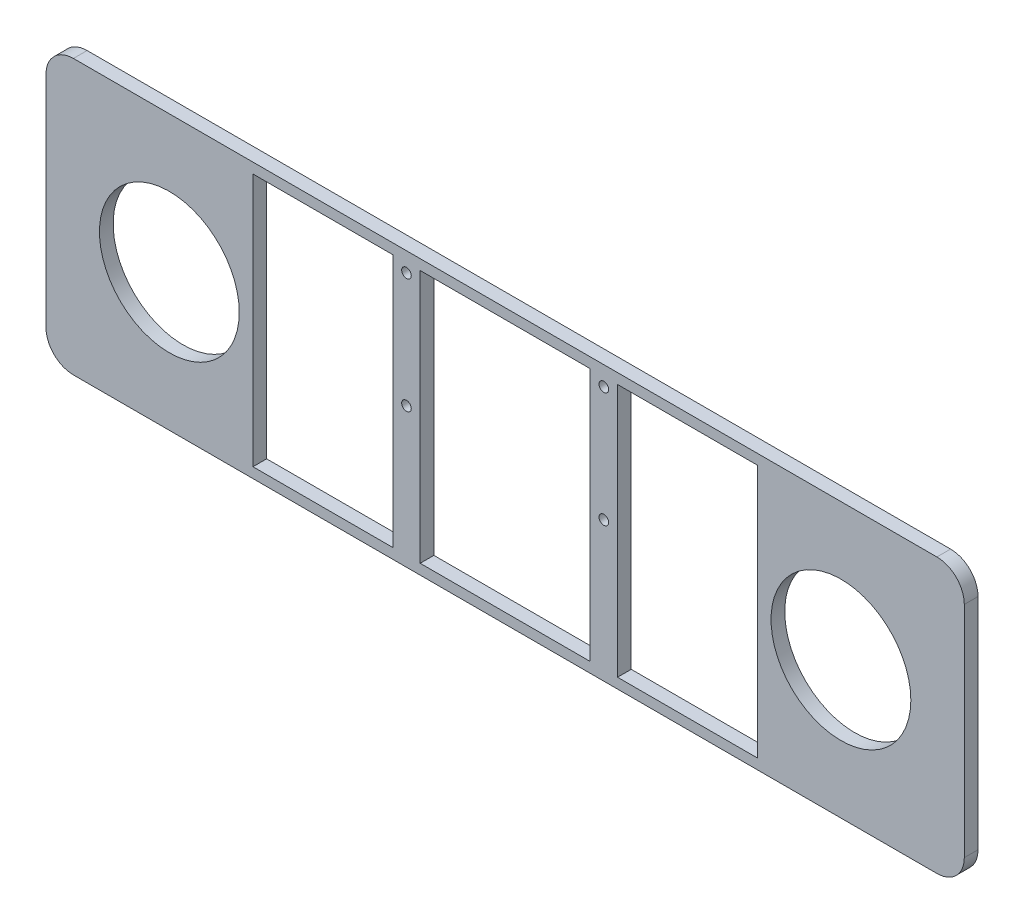
from build123d import *

# Parameters (mm, degrees)
SKETCH1_W           = 335
SKETCH1_H           = 100
SKETCH1_R           = 1.75
SKETCH1_R_2         = 25.5
SKETCH1_W_2         = 62
SKETCH1_H_2         = 92.5
SKETCH1_W_3         = 51
BOSS_EXTRUDE1_DEPTH = 5
FILLET1_R           = 10


with BuildPart() as part:
    # Sketch1 → Boss-Extrude1 (new body)
    with BuildSketch(Plane.XY):
        Rectangle(SKETCH1_W, SKETCH1_H)
        with Locations((-36, 43)):
            Circle(SKETCH1_R, mode=Mode.SUBTRACT)
        with Locations((36, 43)):
            Circle(SKETCH1_R, mode=Mode.SUBTRACT)
        with Locations((36, 1)):
            Circle(SKETCH1_R, mode=Mode.SUBTRACT)
        with Locations((-36, 1)):
            Circle(SKETCH1_R, mode=Mode.SUBTRACT)
        with Locations((-122.5, 0)):
            Circle(SKETCH1_R_2, mode=Mode.SUBTRACT)
        with Locations((122.5, 0)):
            Circle(SKETCH1_R_2, mode=Mode.SUBTRACT)
        Rectangle(SKETCH1_W_2, SKETCH1_H_2, mode=Mode.SUBTRACT)
        with Locations((-66.5, 0)):
            Rectangle(SKETCH1_W_3, SKETCH1_H_2, mode=Mode.SUBTRACT)
        with Locations((66.5, 0)):
            Rectangle(SKETCH1_W_3, SKETCH1_H_2, mode=Mode.SUBTRACT)
    extrude(amount=-BOSS_EXTRUDE1_DEPTH)

    # Fillet1
    fillet1_edges = [part.edges().sort_by_distance(p)[0] for p in [
        (167.5, -50, -2.5),
        (167.5, 50, -2.5),
        (-167.5, 50, -2.5),
        (-167.5, -50, -2.5),
    ]]
    fillet(fillet1_edges, radius=FILLET1_R)


solid = part.part
